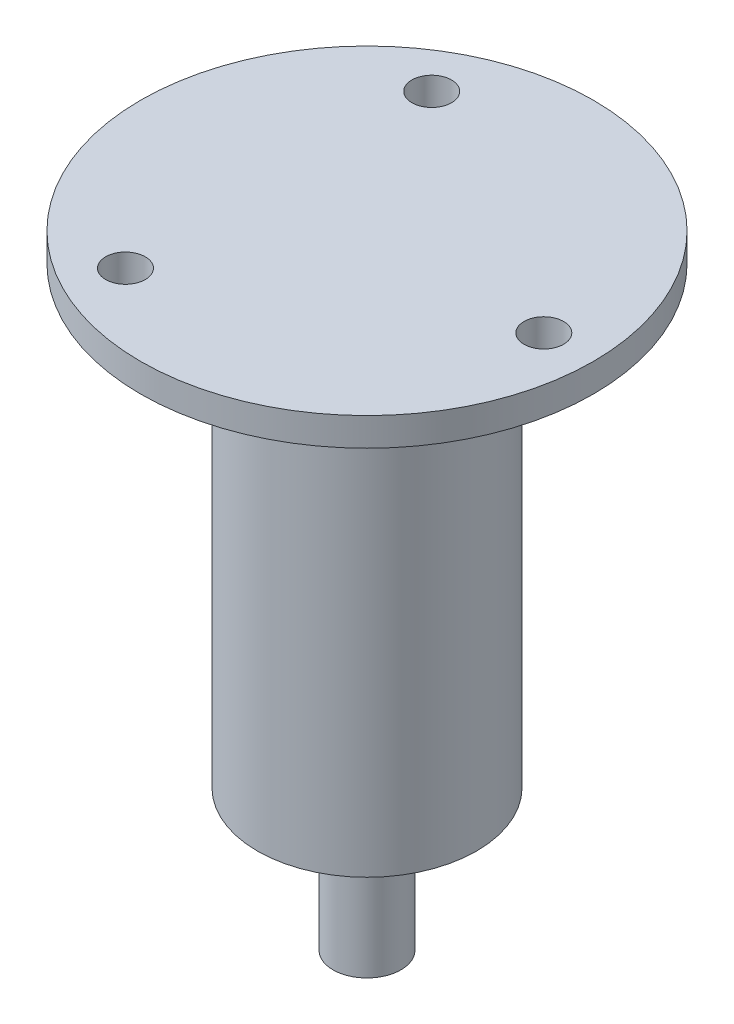
from build123d import *

# Parameters (mm, degrees)
CUT_EXTRUDE1_DEPTH      = 41.924442574
CUT_EXTRUDE1_DEPTH_BACK = 41.924442574
SKETCH2_R               = 1.4
SKETCH4_R               = 2.4


with BuildPart() as part:
    # Sketch1 → Revolve1 (revolve)
    with BuildSketch(Plane(origin=(0, 0, 0), x_dir=(0, 0, -1), z_dir=(1, 0, 0))):
        Polygon((0, 20.05), (2.95, 20.05), (2.95, 14.05), (16, 14.05), (16, 12.05), (7.75, 12.05), (7.75, -20.05), (0, -20.05), align=None)
    revolve(axis=Axis((0, 23.931122449, 0), (0, -1, 0)))

    # Sketch2 → Cut-Extrude1 (cut, two sides: drawn at the far end of the back side and taken through both)
    with BuildSketch(Plane(origin=(0, 14.05, 0), x_dir=(1, 0, 0), z_dir=(0, 1, 0)).offset(-CUT_EXTRUDE1_DEPTH_BACK)):
        with Locations((12.5, 0)):
            Circle(SKETCH2_R)
        with Locations((-6.25, -10.825317547)):
            Circle(SKETCH2_R)
        with Locations((-6.25, 10.825317547)):
            Circle(SKETCH2_R)
    extrude(amount=CUT_EXTRUDE1_DEPTH + CUT_EXTRUDE1_DEPTH_BACK, mode=Mode.SUBTRACT)

    # Sweep1: sweep along a path in Sketch5
    with BuildLine(Plane(origin=(0, 0, 0), x_dir=(0, 0, -1), z_dir=(1, 0, 0))) as sweep1_path:
        Line((30, 52.05), (30, 32.05))
        ThreePointArc((30, 32.05), (28.242640687, 27.807359313), (24, 26.05))
        Line((24, 26.05), (6, 26.05))
        ThreePointArc((6, 26.05), (1.757359313, 24.292640687), (0, 20.05))
        Line((0, 20.05), (0, 0))
        Line((0, 0), (0, -30))
    # Sketch4 → Sweep1 (sweep)
    with BuildSketch(Plane(origin=(0, 0, 0), x_dir=(1, 0, 0), z_dir=(0, 1, 0))):
        Circle(SKETCH4_R)
    sweep(path=sweep1_path.line)


with BuildPart() as body_2:
    # Split2: the piece on the far side of the plane
    add(part.part)
    split(bisect_by=Plane(origin=(0, 14.05, -2.95), x_dir=(0, 0, -1), z_dir=(0, -1, 0)), keep=Keep.BOTTOM)


with BuildPart() as part_1:
    add(part.part)

    # Split2
    split(bisect_by=Plane(origin=(0, 14.05, -2.95), x_dir=(0, 0, -1), z_dir=(0, -1, 0)), keep=Keep.TOP)


solid = part_1.part
